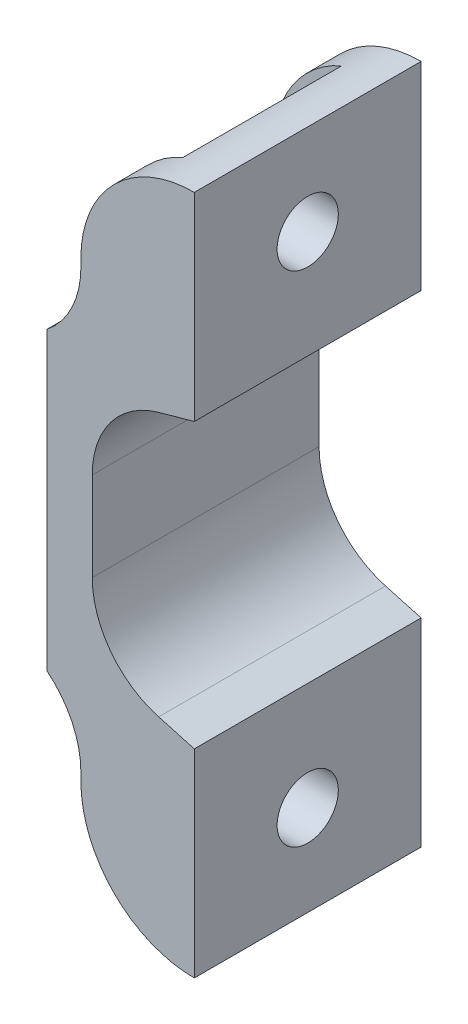
from build123d import *

# Parameters (mm, degrees)
EXTRUDE_1_DEPTH      = 10
EXTRUDE_1_DEPTH_BACK = 10
SKETCH_2_R           = 2.7
CUT_EXTRUDE_1_DEPTH  = 35.190641995
SKETCH_3_W           = 3
SKETCH_3_H           = 17.5
EXTRUDE_2_DEPTH      = 10
FILLET_1_R           = 10
FILLET_2_R           = 8
FILLET_3_R           = 8
FILLET_4_R           = 2


with BuildPart() as part:
    # 草图1 → 凸台-拉伸1 (new, two sides: drawn at the far end of the back side and taken through both)
    with BuildSketch(Plane.XY.offset(-EXTRUDE_1_DEPTH_BACK)):
        Polygon((0, 30), (0, 12.5), (-9, 10), (-9, -10), (0, -12.5), (0, -30), (-4, -30), (-4, -15.540342598), (-13, -13.040342598), (-13, 13.040342598), (-4, 15.540342598), (-4, 30), align=None)
    extrude(amount=EXTRUDE_1_DEPTH + EXTRUDE_1_DEPTH_BACK)

    # 草图2 → 切除-拉伸1 (cut, through all)
    with BuildSketch(Plane(origin=(0, 0, 0), x_dir=(0, 0, -1), z_dir=(1, 0, 0))):
        with Locations((0, 22)):
            Circle(SKETCH_2_R)
        with Locations((0, -22)):
            Circle(SKETCH_2_R)
    extrude(amount=-CUT_EXTRUDE_1_DEPTH, mode=Mode.SUBTRACT)

    # 草图3 → 凸台-拉伸2 (add)
    with BuildSketch(Plane(origin=(0, 0, 0), x_dir=(0, 0, -1), z_dir=(1, 0, 0))):
        with Locations((-8.5, 21.25)):
            Rectangle(SKETCH_3_W, SKETCH_3_H)
        with Locations((8.5, 21.25)):
            Rectangle(SKETCH_3_W, SKETCH_3_H)
        with Locations((-8.5, -21.25)):
            Rectangle(SKETCH_3_W, SKETCH_3_H)
        with Locations((8.5, -21.25)):
            Rectangle(SKETCH_3_W, SKETCH_3_H)
    extrude(amount=-EXTRUDE_2_DEPTH)

    # 圆角1
    # the kernel refuses this fillet: 10 mm, written as the material it takes off along each edge
    with BuildSketch(Plane(origin=(-10, -30, -35), x_dir=(1, 0, 0), z_dir=(0, 0, 1)), Plane(origin=(-10, 30, -35), x_dir=(0, -1, 0), z_dir=(0, 0, 1))) as fillet_1_piece_1:
        with BuildLine():
            CenterArc((FILLET_1_R, FILLET_1_R), FILLET_1_R, 180, 90)
            Line((0, FILLET_1_R), (0, 0))
            Line((0, 0), (FILLET_1_R, 0))
        make_face()
    extrude(amount=53, mode=Mode.SUBTRACT)

    # 圆角2
    # the kernel refuses this fillet: 8 mm, written as the material it adds along each edge
    with BuildSketch(Plane(origin=(-10, 13.873675932, 7), x_dir=(0, 1, 0), z_dir=(0, 0, 1))) as fillet_2_piece_1:
        with BuildLine():
            CenterArc((5.411664665, 8), FILLET_2_R, 218.682187453, 51.317812547)
            Line((-0.833333333, 3), (-0.958233293, 2.9))
            ThreePointArc((-0.958233293, 2.9), (-0.570829532, 1.457176982), (-0.154162866, -0.042823018))
            Line((-0.154162866, -0.042823018), (0, -0.16))
            Line((0, -0.16), (5.411664665, -0.16))
            Line((5.411664665, -0.16), (5.411664665, 0))
        make_face()
    extrude(amount=3)
    with BuildSketch(Plane(origin=(-10, 13.873675932, -7), x_dir=(-0.963517909629979, -0.26764386378595645, 0), z_dir=(0, 0, -1)), Plane(origin=(-10, -13.873675932, 7), x_dir=(-0.963517909629979, 0.26764386378595645, 0), z_dir=(0, 0, 1))) as fillet_2_piece_2:
        with BuildLine():
            CenterArc((6.259744437, 7.355386736), FILLET_2_R, 195.524110997, 51.317812547)
            Line((-1.44839884, 5.214235826), (-1.602561706, 5.171412807))
            Line((-1.602561706, 5.171412807), (-0.154162866, -0.042823018))
            Line((-0.154162866, -0.042823018), (0, -0.16))
            ThreePointArc((0, -0.16), (1.556795141, -0.16), (3.050667199, -0.147107735))
            Line((3.050667199, -0.147107735), (3.113590282, 0))
        make_face()
    extrude(amount=3)
    with BuildSketch(Plane(origin=(-10, -13.873675932, -7), x_dir=(-0.963517909629979, 0.26764386378595645, 0), z_dir=(0, 0, -1))) as fillet_2_piece_3:
        with BuildLine():
            CenterArc((6.259744437, -7.355386736), FILLET_2_R, 113.158076457, 51.317812547)
            Line((-1.44839884, -5.214235826), (-1.602561706, -5.171412807))
            Line((-1.602561706, -5.171412807), (-0.154162866, 0.042823018))
            Line((-0.154162866, 0.042823018), (0, 0.16))
            ThreePointArc((0, 0.16), (1.556795141, 0.16), (3.050667199, 0.147107735))
            Line((3.050667199, 0.147107735), (3.113590282, 0))
        make_face()
    extrude(amount=3)

    # 圆角3
    fillet_3_edges = [part.edges().sort_by_distance(p)[0] for p in [
        (-9, 10, 0),
        (-9, -10, 0),
    ]]
    fillet(fillet_3_edges, radius=FILLET_3_R)

    # 圆角4
    fillet_4_edges = [part.edges().sort_by_distance(p)[0] for p in [
        (-4, 15.540342598, 0),
        (-4, -15.540342598, 0),
    ]]
    fillet(fillet_4_edges, radius=FILLET_4_R)


solid = part.part
